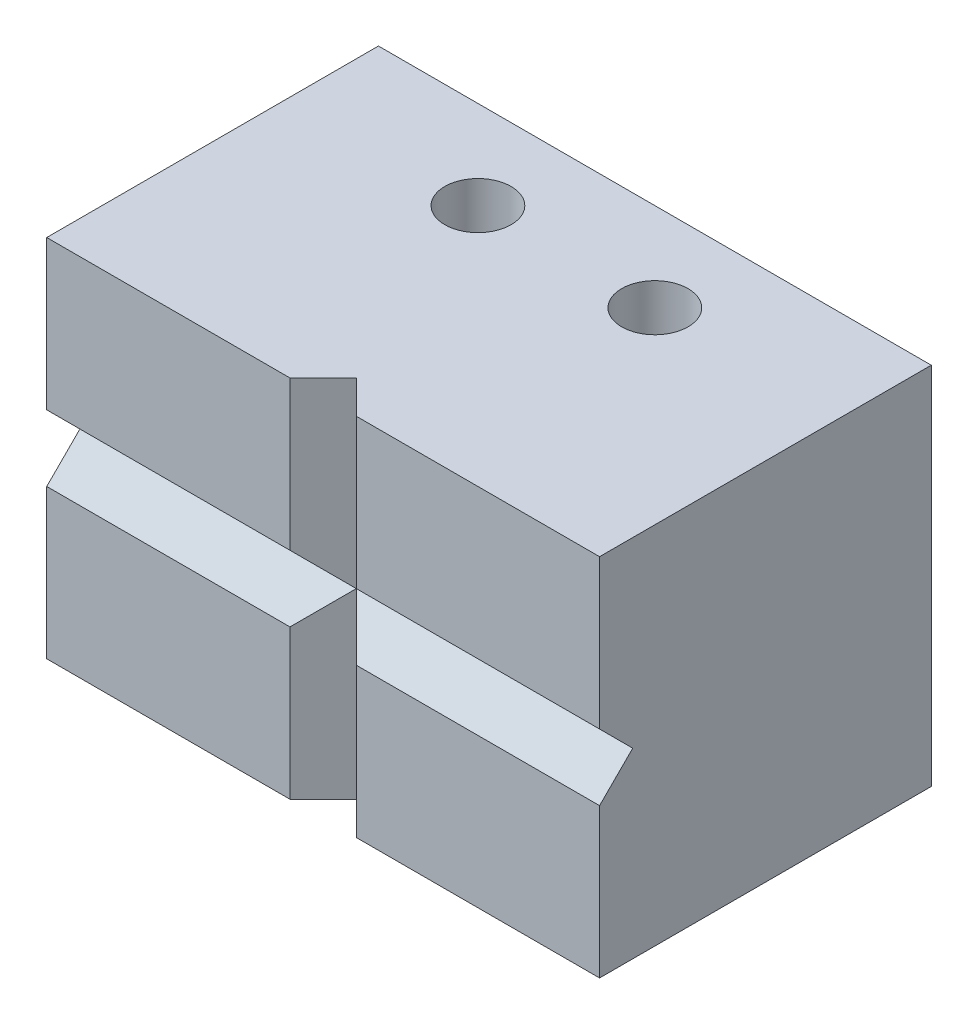
from build123d import *

# Parameters (mm, degrees)
BOSS_EXTRUDE1_DEPTH       = 15
BOSS_EXTRUDE1_DEPTH_BACK  = 1.5
SKETCH1_R                 = 1.5
CUT_EXTRUDE1_REACH        = 32.104
F_8_0MM_DOWEL_HOLE3_D     = 8
F_8_0MM_DOWEL_HOLE3_DEPTH = 9
F_8_0MM_DOWEL_HOLE3_TIP   = 2.403442476
THREAD2_PITCH             = 1
THREAD2_FROM              = 1


with BuildPart() as part:
    # Sketch1 → Boss-Extrude1 (new, two sides: drawn at the far end of the back side and taken through both)
    with BuildSketch(Plane(origin=(0, 0, 0), x_dir=(1, 0, 0), z_dir=(0, 1, 0)).offset(-BOSS_EXTRUDE1_DEPTH_BACK)):
        Polygon((12.5, -7.5), (1.5, -7.5), (0, -6), (-1.5, -7.5), (-12.5, -7.5), (-12.5, 7.5), (12.5, 7.5), align=None)
        with Locations(Location((-4, 3.5, 0), (0, 0, 270))):
            Circle(SKETCH1_R, mode=Mode.SUBTRACT)
        with Locations(Location((4, 3.5, 0), (0, 0, 90))):
            Circle(SKETCH1_R, mode=Mode.SUBTRACT)
    extrude(amount=BOSS_EXTRUDE1_DEPTH + BOSS_EXTRUDE1_DEPTH_BACK)

    # Cut-Extrude1: up to this face of the body (flat: up to its plane)
    cut_extrude1_end = Plane(part.part.faces().sort_by_distance((-12.5, 6.75, 0))[0])
    # Sketch3 → Cut-Extrude1 (cut, up to the picked face)
    with BuildSketch(Plane(origin=(12.5, 0, 0), x_dir=(0, 0, -1), z_dir=(1, 0, 0)), mode=Mode.PRIVATE) as cut_extrude1_sk1:
        Polygon((-7.5, 8.25), (-6, 6.75), (-7.5, 5.25), align=None)
    cut_extrude1_tool1 = split(extrude(cut_extrude1_sk1.sketch, amount=-CUT_EXTRUDE1_REACH, mode=Mode.PRIVATE), bisect_by=cut_extrude1_end, keep=Keep.BOTH, mode=Mode.PRIVATE)
    add(cut_extrude1_tool1.solids().sort_by(Axis((12.5, 6.75, 7), (-1, 0, 0)))[0], mode=Mode.SUBTRACT)

    # Ø8.0mm Dowel Hole3
    with Locations(Plane(origin=(0, 0, -7.5), x_dir=(-1, 0, 0), z_dir=(0, 0, -1))):
        with Locations((0, 6.75)):
            Hole(F_8_0MM_DOWEL_HOLE3_D / 2, depth=F_8_0MM_DOWEL_HOLE3_DEPTH)
            with Locations((0, 0, -(F_8_0MM_DOWEL_HOLE3_DEPTH + F_8_0MM_DOWEL_HOLE3_TIP / 2))):  # 118° drill point
                Cone(0, F_8_0MM_DOWEL_HOLE3_D / 2, F_8_0MM_DOWEL_HOLE3_TIP, mode=Mode.SUBTRACT)

    # Thread2: arcs per turn and ends read off the stored shape
    # Thread2: the profile of Thread Profile2 profile screwed along a right-hand helix through 11 turns, 8 arcs to a turn; built about Z, then put on its axis
    thread2_z = Axis((0, 0, 0), (0, 0, 1))
    thread2_corners = [(4.0003, 0, -0.000173205), (4.0003, 0, 0.875173202), (3.458734125, 0, 0.562499999), (3.458734125, 0, 0.312499999)]
    with BuildLine(mode=Mode.PRIVATE) as thread2_profile:
        Line(thread2_corners[0], thread2_corners[1])
        Line(thread2_corners[1], thread2_corners[2])
        Line(thread2_corners[2], thread2_corners[3])
        Line(thread2_corners[3], thread2_corners[0])
    thread2_cap = Face(thread2_profile.wire())
    thread2_turn_angles = [0, 22.5, 45, 67.5, 90, 112.5, 135, 157.5, 180, 202.5, 225, 247.5, 270, 292.5, 315, 337.5, 360]
    thread2_turn_weights = [1, 0.9238795325112867, 1, 0.9238795325112867, 1, 0.9238795325112867, 1, 0.9238795325112867, 1, 0.9238795325112867, 1, 0.9238795325112867, 1, 0.9238795325112867, 1, 0.9238795325112867, 1]
    thread2_turn_rails = [Edge.make_bspline([Vector(p[0], p[1], 0).rotate(thread2_z, thread2_turn_angles[k]) / thread2_turn_weights[k] + Vector(0, 0, p[2] + THREAD2_PITCH * thread2_turn_angles[k] / 360) for k in range(17)], [0, 0, 0, 1, 1, 2, 2, 3, 3, 4, 4, 5, 5, 6, 6, 7, 7, 8, 8, 8], 2, thread2_turn_weights) for p in thread2_corners]
    thread2_turn_sides = [Face.make_surface_from_curves(thread2_turn_rails[p[0]], thread2_turn_rails[p[1]]) for p in [(0, 1), (1, 2), (2, 3), (3, 0)]]
    thread2 = Plane(origin=(0, 6.75, -8.5), x_dir=(1, 0, 0), z_dir=(0, 0, 1)) * split(Solid(Shell([*[p.moved(Location((0, 0, THREAD2_PITCH * i))) for i in range(11) for p in thread2_turn_sides], thread2_cap, thread2_cap.rotate(thread2_z, 3960).moved(Location((0, 0, THREAD2_PITCH * 3960 / 360)))])), bisect_by=Plane.XY.offset(THREAD2_FROM), keep=Keep.TOP, mode=Mode.PRIVATE)
    add(thread2)


solid = part.part
